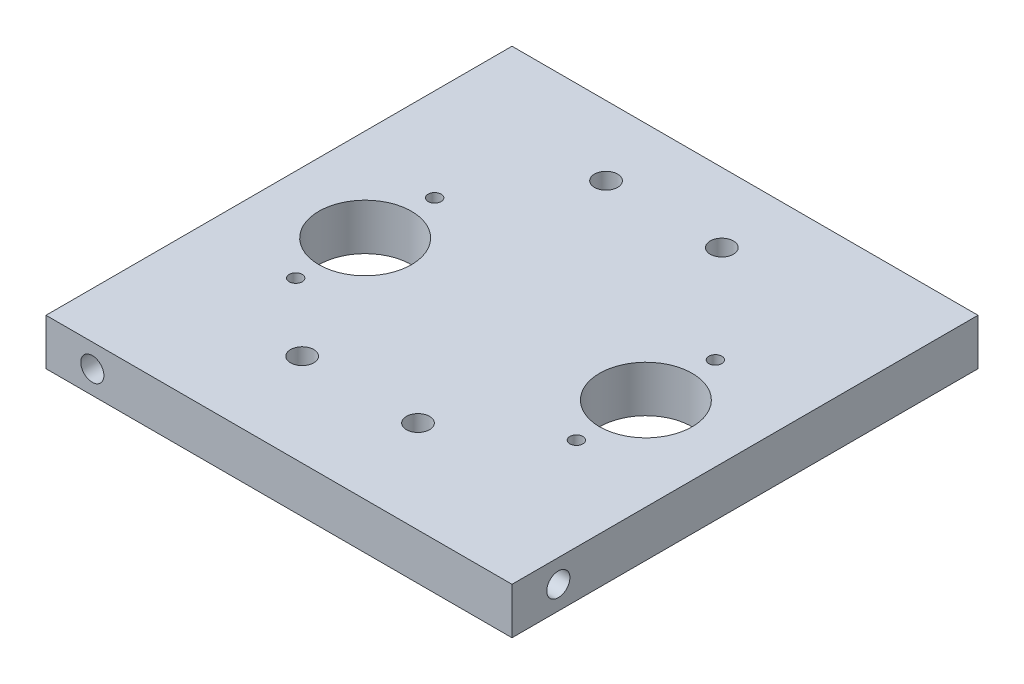
from build123d import *

# Parameters (mm, degrees)
SKETCH1_W                      = 127.762
SKETCH1_H                      = 127.762
MAIN_PLATE_DEPTH               = 12.7
SKETCH2_R                      = 3.175
U_BOLT_HOLE_DEPTH              = 12.7
U_BOLT_PATTERN_COUNT           = 2
U_BOLT_PATTERN_PITCH           = 31.75
U_BOLT_PATTERN_COUNT_DIR2      = 2
U_BOLT_PATTERN_PITCH_DIR2      = 83.312
SKETCH3_R                      = 1.778
RAPTOR_BOLT_HOLE_DEPTH         = 12.7
RAPTOR_BOLT_PATTERN_COUNT      = 2
RAPTOR_BOLT_PATTERN_PITCH      = 38.1
RAPTOR_BOLT_PATTERN_COUNT_DIR2 = 2
RAPTOR_BOLT_PATTERN_PITCH_DIR2 = 76.962
SKETCH4_R                      = 12.7
CO2_CYLINDER_HOLE_DEPTH        = 12.7
CO2_PATTERN_COUNT              = 2
CO2_PATTERN_PITCH              = 76.962
SKETCH5_R                      = 3.175
FRAME_ATTACHMENT_HOLE_1_DEPTH  = 12.7
SKETCH6_R                      = 3.175
FRAME_ATTACHMENT_HOLE_2_DEPTH  = 12.7
SKETCH7_R                      = 3.175
FRAME_ATTACHMENT_HOLE_3_DEPTH  = 12.7
SKETCH8_R                      = 3.175
FRAME_ATTACHMENT_HOLE_4_DEPTH  = 12.7


with BuildPart() as part:
    # Sketch1 → Main Plate (new body)
    with BuildSketch(Plane(origin=(0, 0, 0), x_dir=(1, 0, 0), z_dir=(0, 1, 0))):
        with Locations((63.881, 63.881)):
            Rectangle(SKETCH1_W, SKETCH1_H)
    extrude(amount=MAIN_PLATE_DEPTH)

    # Sketch2 → U-Bolt Hole (cut)
    with BuildSketch(Plane(origin=(0, 12.7, 0), x_dir=(1, 0, 0), z_dir=(0, 1, 0))):
        with Locations((44.831, 108.712)):
            Circle(SKETCH2_R)
    u_bolt_hole = extrude(amount=-U_BOLT_HOLE_DEPTH, mode=Mode.SUBTRACT)

    # U-Bolt Pattern: U-Bolt Hole 2 × 2
    with Locations(*[(i * U_BOLT_PATTERN_PITCH, 0, j * U_BOLT_PATTERN_PITCH_DIR2) for i in range(U_BOLT_PATTERN_COUNT) for j in range(U_BOLT_PATTERN_COUNT_DIR2) if (i, j) != (0, 0)]):
        add(u_bolt_hole, mode=Mode.SUBTRACT)

    # Sketch3 → Raptor Bolt Hole (cut)
    with BuildSketch(Plane(origin=(0, 12.7, 0), x_dir=(1, 0, 0), z_dir=(0, 1, 0))):
        with Locations((25.4, 43.053)):
            Circle(SKETCH3_R)
    raptor_bolt_hole = extrude(amount=-RAPTOR_BOLT_HOLE_DEPTH, mode=Mode.SUBTRACT)

    # Raptor Bolt Pattern: Raptor Bolt Hole 2 × 2
    with Locations(*[(j * RAPTOR_BOLT_PATTERN_PITCH_DIR2, 0, -i * RAPTOR_BOLT_PATTERN_PITCH) for i in range(RAPTOR_BOLT_PATTERN_COUNT) for j in range(RAPTOR_BOLT_PATTERN_COUNT_DIR2) if (i, j) != (0, 0)]):
        add(raptor_bolt_hole, mode=Mode.SUBTRACT)

    # Sketch4 → Co2 Cylinder Hole (cut)
    with BuildSketch(Plane(origin=(0, 12.7, 0), x_dir=(1, 0, 0), z_dir=(0, 1, 0))):
        with Locations((25.4, 62.103)):
            Circle(SKETCH4_R)
    co2_cylinder_hole = extrude(amount=-CO2_CYLINDER_HOLE_DEPTH, mode=Mode.SUBTRACT)

    # Co2 Pattern: Co2 Cylinder Hole ×2
    with Locations(*[(i * CO2_PATTERN_PITCH, 0, 0) for i in range(1, CO2_PATTERN_COUNT)]):
        add(co2_cylinder_hole, mode=Mode.SUBTRACT)

    # Sketch5 → Frame attachment hole 1 (cut)
    with BuildSketch(Plane.XY):
        with Locations((12.7, 6.310287018)):
            Circle(SKETCH5_R)
    extrude(amount=-FRAME_ATTACHMENT_HOLE_1_DEPTH, mode=Mode.SUBTRACT)

    # Sketch6 → Frame attachment hole 2 (cut)
    with BuildSketch(Plane.ZY):
        with Locations((-115.062, 6.35)):
            Circle(SKETCH6_R)
    extrude(amount=-FRAME_ATTACHMENT_HOLE_2_DEPTH, mode=Mode.SUBTRACT)

    # Sketch7 → Frame attachment hole 3 (cut)
    with BuildSketch(Plane(origin=(0, 0, -127.762), x_dir=(-1, 0, 0), z_dir=(0, 0, -1))):
        with Locations((-115.062, 6.35)):
            Circle(SKETCH7_R)
    extrude(amount=-FRAME_ATTACHMENT_HOLE_3_DEPTH, mode=Mode.SUBTRACT)

    # Sketch8 → Frame attachment hole 4 (cut)
    with BuildSketch(Plane(origin=(127.762, 0, 0), x_dir=(0, 0, -1), z_dir=(1, 0, 0))):
        with Locations((12.7, 6.35)):
            Circle(SKETCH8_R)
    extrude(amount=-FRAME_ATTACHMENT_HOLE_4_DEPTH, mode=Mode.SUBTRACT)


solid = part.part
